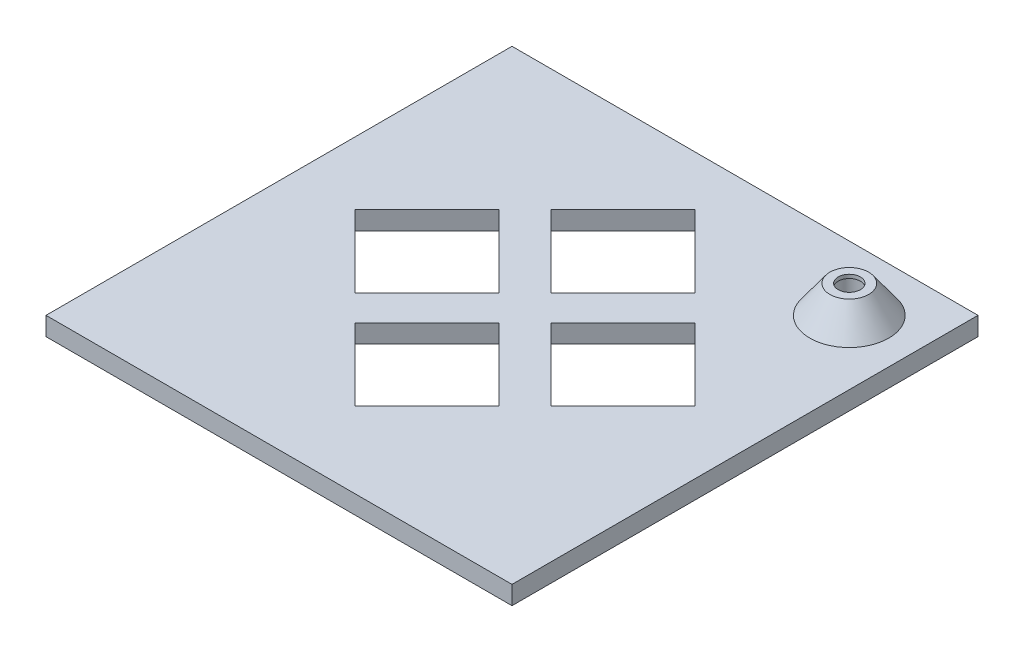
from build123d import *

# Parameters (mm, degrees)
SKETCH1_W               = 126
SKETCH1_H               = 126
BOSS_EXTRUDE1_DEPTH     = 5
SKETCH3_R               = 12.5
BOSS_EXTRUDE2_DEPTH     = 7.5
SKETCH4_R               = 3.45
CUT_EXTRUDE1_DEPTH      = 11.5
SKETCH6_R               = 3
CUT_EXTRUDE2_DEPTH      = 179.628805068
CHAMFER1_SIZE           = 10
CHAMFER1_SIZE_2         = 7.26542528
CUT_EXTRUDE3_DEPTH      = 179.348675353
CUT_EXTRUDE3_DEPTH_BACK = 179.348675353


with BuildPart() as part:
    # Sketch1 → Boss-Extrude1 (new body)
    with BuildSketch(Plane(origin=(0, 0, 0), x_dir=(1, 0, 0), z_dir=(0, 1, 0))):
        with Locations((63, 63)):
            Rectangle(SKETCH1_W, SKETCH1_H)
    extrude(amount=BOSS_EXTRUDE1_DEPTH)

    # Sketch3 → Boss-Extrude2 (add)
    with BuildSketch(Plane(origin=(0, 5, 0), x_dir=(1, 0, 0), z_dir=(0, 1, 0))):
        with Locations(Location((108.6, 108.6, 0), (0, 0, 90))):
            Circle(SKETCH3_R)
    extrude(amount=BOSS_EXTRUDE2_DEPTH)

    # Sketch4 → Cut-Extrude1 (cut)
    with BuildSketch(Plane.XZ):
        with Locations(Location((108.6, -108.6, 0), (0, 0, 270))):
            Circle(SKETCH4_R)
    extrude(amount=-CUT_EXTRUDE1_DEPTH, mode=Mode.SUBTRACT)

    # Sketch6 → Cut-Extrude2 (cut, through all)
    with BuildSketch(Plane(origin=(0, 12.5, 0), x_dir=(1, 0, 0), z_dir=(0, 1, 0))):
        with Locations(Location((108.6, 108.6, 0), (0, 0, 270))):
            Circle(SKETCH6_R)
    extrude(amount=-CUT_EXTRUDE2_DEPTH, mode=Mode.SUBTRACT)

    # Chamfer1
    # the kernel refuses this chamfer: 10, 7.26542528 mm, written as the material it takes off along each edge
    with BuildSketch(Plane(origin=(108.6, 12.5, -108.6), x_dir=(0, 0, -1), z_dir=(1, 0, 0))) as chamfer1_piece_1_section:
        Polygon((12.5, -CHAMFER1_SIZE), (12.5 - CHAMFER1_SIZE_2, 0), (12.5, 0), align=None)
    chamfer1_piece_1 = revolve(axis=Axis((108.6, 12.5, -108.6), (0, 1, 0)), mode=Mode.PRIVATE)
    chamfer1_piece_1 = split(chamfer1_piece_1, bisect_by=Plane(origin=(108.6, 5, -100.650989912), z_dir=(0, 1, 0)), keep=Keep.TOP, mode=Mode.PRIVATE)
    add(chamfer1_piece_1, mode=Mode.SUBTRACT)

    # Sketch7 → Cut-Extrude3 (cut, two sides: drawn at the far end of the back side and taken through both)
    with BuildSketch(Plane(origin=(0, 5, 0), x_dir=(1, 0, 0), z_dir=(0, 1, 0)).offset(-CUT_EXTRUDE3_DEPTH_BACK)):
        Polygon((70, 66.5), (89.5, 86), (109, 66.5), (89.5, 47), align=None)
        Polygon((63, 73.5), (82.5, 93), (63, 112.5), (43.5, 93), align=None)
        Polygon((56, 66.5), (36.5, 86), (17, 66.5), (36.5, 47), align=None)
        Polygon((63, 59.5), (43.5, 40), (63, 20.5), (82.5, 40), align=None)
    extrude(amount=CUT_EXTRUDE3_DEPTH + CUT_EXTRUDE3_DEPTH_BACK, mode=Mode.SUBTRACT)


solid = part.part
